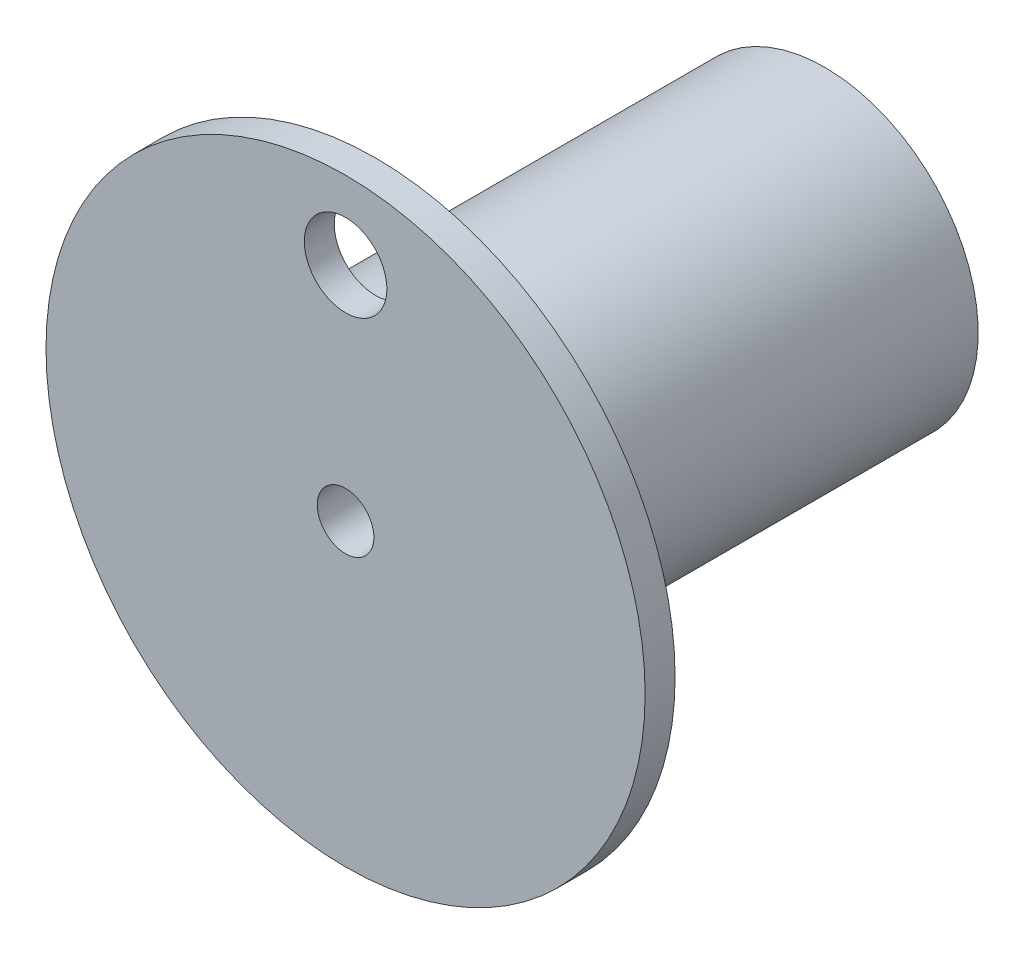
from build123d import *

# Parameters (mm, degrees)
SKETCH1_R           = 6.5
BOSS_EXTRUDE1_DEPTH = 19.05
SKETCH2_R           = 12.7
BOSS_EXTRUDE2_DEPTH = 1.27
SKETCH3_R           = 1.2
CUT_EXTRUDE1_DEPTH  = 28.11977876
SKETCH4_R           = 1.75
CUT_EXTRUDE2_DEPTH  = 7.62


with BuildPart() as part:
    # Sketch1 → Boss-Extrude1 (new body)
    with BuildSketch(Plane.XY):
        Circle(SKETCH1_R)
    extrude(amount=BOSS_EXTRUDE1_DEPTH)

    # Sketch2 → Boss-Extrude2 (add)
    with BuildSketch(Plane.XY.offset(19.05)):
        Circle(SKETCH2_R)
    extrude(amount=BOSS_EXTRUDE2_DEPTH)

    # Sketch3 → Cut-Extrude1 (cut, through all)
    with BuildSketch(Plane(origin=(0, 0, 0), x_dir=(-1, 0, 0), z_dir=(0, 0, -1))):
        Circle(SKETCH3_R)
    extrude(amount=-CUT_EXTRUDE1_DEPTH, mode=Mode.SUBTRACT)

    # Sketch4 → Cut-Extrude2 (cut)
    with BuildSketch(Plane(origin=(0, 0, 19.05), x_dir=(-1, 0, 0), z_dir=(0, 0, -1))):
        with Locations((0, 9.398)):
            Circle(SKETCH4_R)
    extrude(amount=-CUT_EXTRUDE2_DEPTH, mode=Mode.SUBTRACT)


solid = part.part
